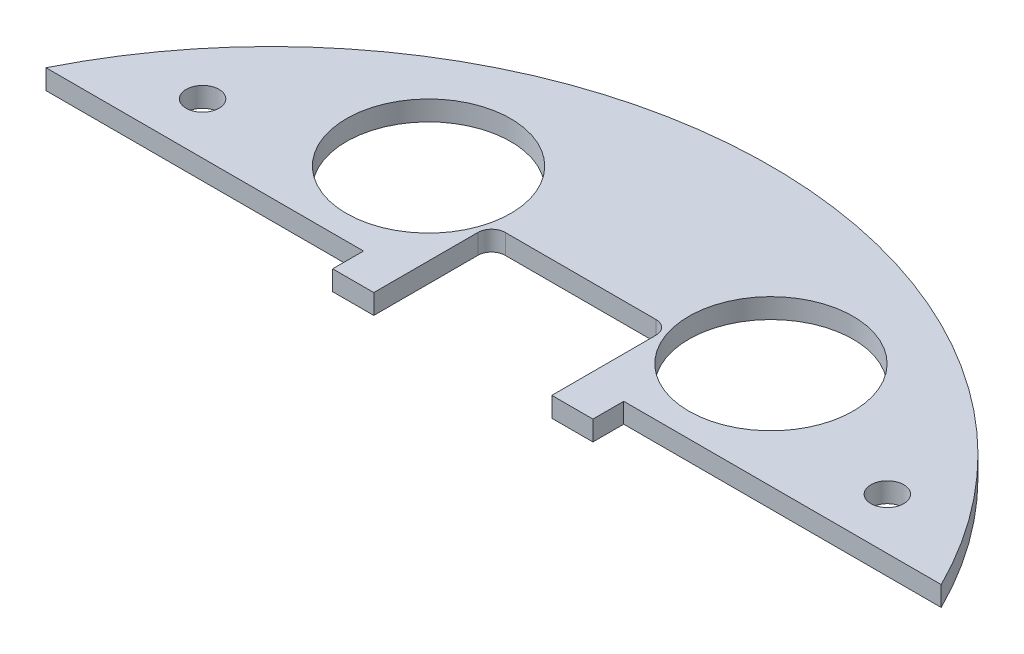
from build123d import *

# Parameters (mm, degrees)
BOSS_EXTRUDE1_DEPTH  = 2.9
SOLENOID_PLACEMENT_W = 38
SOLENOID_PLACEMENT_H = 64
CUT_EXTRUDE1_DEPTH   = 104.278313309
CUT_EXTRUDE4_DEPTH   = 104.278313309
SKETCH5_R            = 12
CUT_EXTRUDE5_DEPTH   = 104.278313309
SKETCH6_R            = 2.4
CUT_EXTRUDE6_DEPTH   = 104.278313309
CUT_EXTRUDE3_DEPTH   = 104.278313309


with BuildPart() as part:
    # Sketch1 → Boss-Extrude1 (new body)
    with BuildSketch(Plane(origin=(0, 0, 0), x_dir=(1, 0, 0), z_dir=(0, 1, 0))):
        with BuildLine():
            ThreePointArc((36.856602833, -63.012624351), (0, 73), (-36.856602833, -63.012624351))
            ThreePointArc((-36.856602833, -63.012624351), (-33.368752207, -63.602994345), (-30.363140064, -61.737536127))
            ThreePointArc((-30.363140064, -61.737536127), (0, -46.75), (30.363140064, -61.737536127))
            ThreePointArc((30.363140064, -61.737536127), (33.368752207, -63.602994345), (36.856602833, -63.012624351))
        make_face()
    extrude(amount=BOSS_EXTRUDE1_DEPTH)

    # solenoid placement → Cut-Extrude1 (cut, through all)
    with BuildSketch(Plane(origin=(0, 2.9, 0), x_dir=(1, 0, 0), z_dir=(0, 1, 0))):
        with Locations((0, -4)):
            Rectangle(SOLENOID_PLACEMENT_W, SOLENOID_PLACEMENT_H)
    extrude(amount=-CUT_EXTRUDE1_DEPTH, mode=Mode.SUBTRACT)

    # Sketch4 → Cut-Extrude4 (cut, through all)
    with BuildSketch(Plane(origin=(0, 2.9, 0), x_dir=(1, 0, 0), z_dir=(0, 1, 0))):
        with BuildLine():
            Line((-13, 28), (13, 28))
            Line((13, 28), (13, 43.2))
            ThreePointArc((13, 43.2), (12.414213562, 44.614213562), (11, 45.2))
            Line((11, 45.2), (-11, 45.2))
            ThreePointArc((-11, 45.2), (-12.414213562, 44.614213562), (-13, 43.2))
            Line((-13, 43.2), (-13, 28))
        make_face()
    extrude(amount=-CUT_EXTRUDE4_DEPTH, mode=Mode.SUBTRACT)

    # Sketch5 → Cut-Extrude5 (cut, through all)
    with BuildSketch(Plane(origin=(0, 2.9, 0), x_dir=(1, 0, 0), z_dir=(0, 1, 0))):
        with Locations((-25, 48)):
            Circle(SKETCH5_R)
        with Locations((25, 48)):
            Circle(SKETCH5_R)
    extrude(amount=-CUT_EXTRUDE5_DEPTH, mode=Mode.SUBTRACT)

    # Sketch6 → Cut-Extrude6 (cut, through all)
    with BuildSketch(Plane(origin=(0, 2.9, 0), x_dir=(1, 0, 0), z_dir=(0, 1, 0))):
        with Locations((40, -40)):
            Circle(SKETCH6_R)
        with Locations((-40, -40)):
            Circle(SKETCH6_R)
        with Locations((-50, 40)):
            Circle(SKETCH6_R)
        with Locations((50, 40)):
            Circle(SKETCH6_R)
    extrude(amount=-CUT_EXTRUDE6_DEPTH, mode=Mode.SUBTRACT)

    # Sketch3 → Cut-Extrude3 (cut, through all)
    with BuildSketch(Plane(origin=(0, 2.9, 0), x_dir=(1, 0, 0), z_dir=(0, 1, 0))):
        Polygon((-19, 28), (19, 28), (19, 32.5), (73, 32.5), (73, -32.5), (-73, -32.5), (-73, 32.5), (-19, 32.5), align=None)
    extrude(amount=-CUT_EXTRUDE3_DEPTH, mode=Mode.SUBTRACT)


with BuildPart() as cut_extrude3_piece_1:
    # of the separate pieces the step leaves, piece 1, a body of its own (cut_extrude3_pieces)
    add(part.part.solids().sort_by_distance((65.366275709, 0, -32.5))[0])


with BuildPart() as cut_extrude3_piece_2:
    # of the separate pieces the step leaves, piece 2, a body of its own (cut_extrude3_pieces)
    add(part.part.solids().sort_by_distance((-36.856602833, 0, 63.012624351))[0])


solid = cut_extrude3_piece_1.part
